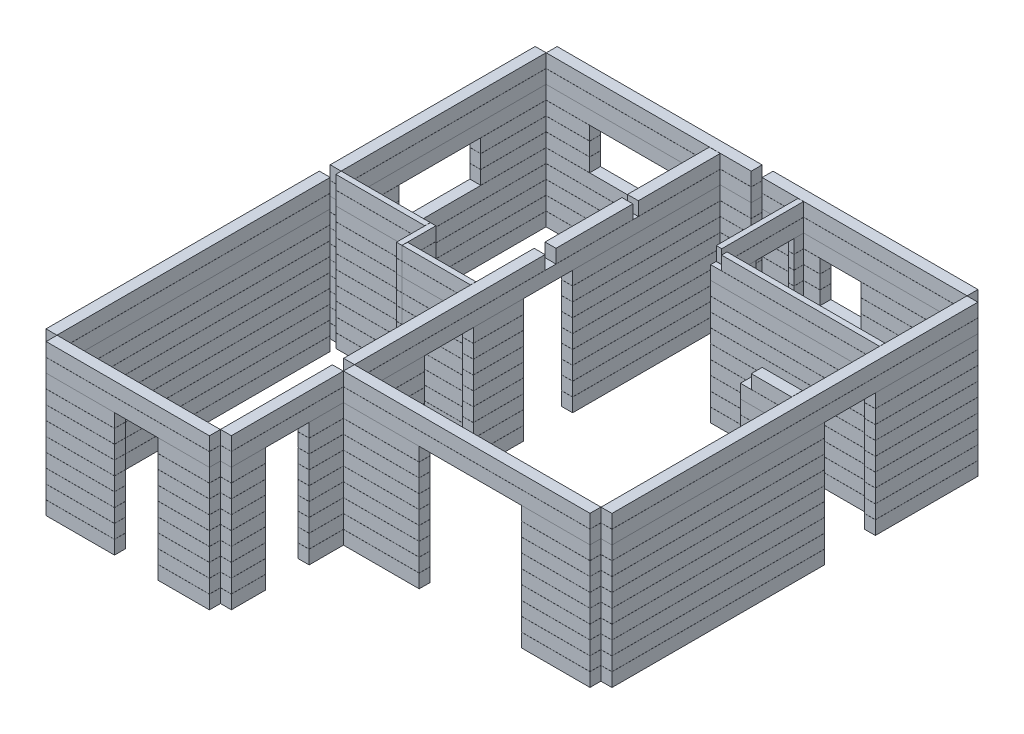
from build123d import *

# Parameters (mm, degrees)
SKETCH_1_W             = 200
SKETCH_1_H             = 1881
EXTRUDE_3_DEPTH        = 250
SKETCH_1_W_2           = 3762
SKETCH_1_H_2           = 200
EXTRUDE_3_2_DEPTH      = 250
SKETCH_1_H_3           = 3762
EXTRUDE_3_3_DEPTH      = 250
SKETCH_1_W_3           = 1254
EXTRUDE_3_4_DEPTH      = 250
SKETCH_1_H_4           = 627
EXTRUDE_3_5_DEPTH      = 250
EXTRUDE_3_6_DEPTH      = 250
EXTRUDE_3_7_DEPTH      = 250
SKETCH_1_W_4           = 942
EXTRUDE_3_8_DEPTH      = 250
SKETCH_1_W_5           = 1390
EXTRUDE_3_9_DEPTH      = 250
SKETCH_1_H_5           = 3904
EXTRUDE_3_10_DEPTH     = 250
SKETCH_1_W_6           = 100
SKETCH_1_H_6           = 173
EXTRUDE_3_11_DEPTH     = 250
SKETCH_1_H_7           = 2709
EXTRUDE_3_12_DEPTH     = 250
SKETCH_1_H_8           = 1281
EXTRUDE_3_13_DEPTH     = 250
SKETCH_1_H_9           = 622
EXTRUDE_3_14_DEPTH     = 250
SKETCH_1_W_7           = 1633
SKETCH_1_H_10          = 100
EXTRUDE_3_15_DEPTH     = 250
EXTRUDE_3_16_DEPTH     = 250
SKETCH_1_W_8           = 3097
EXTRUDE_3_17_DEPTH     = 250
EXTRUDE_3_18_DEPTH     = 250
SKETCH_1_H_11          = 922
EXTRUDE_3_19_DEPTH     = 250
SKETCH_1_W_9           = 940
EXTRUDE_3_20_DEPTH     = 250
SKETCH_1_H_12          = 5016
EXTRUDE_3_21_DEPTH     = 250
EXTRUDE_3_22_DEPTH     = 250
PATTERN_LINEAR_1_COUNT = 9
PATTERN_LINEAR_1_PITCH = 252
SKETCH_2_W             = 1500
SKETCH_2_H             = 754
CUT_EXTRUDE_2_DEPTH    = 250
SKETCH_3_W             = 1500
SKETCH_3_H             = 754
SKETCH_3_W_2           = 750
CUT_EXTRUDE_3_DEPTH    = 593
SKETCH_4_W             = 3762
SKETCH_4_H             = 200
EXTRUDE_4_DEPTH        = 250
EXTRUDE_4_2_DEPTH      = 250
SKETCH_4_W_2           = 100
SKETCH_4_H_2           = 1500
EXTRUDE_4_3_DEPTH      = 250
SKETCH_4_W_3           = 3097
SKETCH_4_H_3           = 100
EXTRUDE_4_4_DEPTH      = 250
SKETCH_4_W_4           = 200
SKETCH_4_H_4           = 6715
EXTRUDE_4_5_DEPTH      = 250
SKETCH_4_W_5           = 940
EXTRUDE_4_6_DEPTH      = 250
SKETCH_4_H_5           = 6712
EXTRUDE_4_7_DEPTH      = 250
SKETCH_4_W_6           = 4525
EXTRUDE_4_8_DEPTH      = 250
SKETCH_4_H_6           = 2054
EXTRUDE_4_9_DEPTH      = 250
SKETCH_4_W_7           = 2996
EXTRUDE_4_10_DEPTH     = 250
SKETCH_4_H_7           = 5016
EXTRUDE_4_11_DEPTH     = 250
SKETCH_4_H_8           = 3762
EXTRUDE_4_12_DEPTH     = 250
SKETCH_4_W_8           = 1633
EXTRUDE_4_13_DEPTH     = 250
SKETCH_4_H_9           = 622
EXTRUDE_4_14_DEPTH     = 250
SKETCH_4_W_9           = 1254
EXTRUDE_4_15_DEPTH     = 250
EXTRUDE_START          = 252
SKETCH_4_2_W           = 3762
SKETCH_4_2_H           = 200
EXTRUDE_5_DEPTH        = 250
EXTRUDE_5_2_DEPTH      = 250
SKETCH_4_2_W_2         = 100
SKETCH_4_2_H_2         = 1500
EXTRUDE_5_3_DEPTH      = 250
SKETCH_4_2_W_3         = 3097
SKETCH_4_2_H_3         = 100
EXTRUDE_5_4_DEPTH      = 250
SKETCH_4_2_W_4         = 200
SKETCH_4_2_H_4         = 6715
EXTRUDE_5_5_DEPTH      = 250
SKETCH_4_2_W_5         = 940
EXTRUDE_5_6_DEPTH      = 250
SKETCH_4_2_H_5         = 6712
EXTRUDE_5_7_DEPTH      = 250
SKETCH_4_2_W_6         = 4525
EXTRUDE_5_8_DEPTH      = 250
SKETCH_4_2_H_6         = 2054
EXTRUDE_5_9_DEPTH      = 250
SKETCH_4_2_W_7         = 2996
EXTRUDE_5_10_DEPTH     = 250
SKETCH_4_2_H_7         = 5016
EXTRUDE_5_11_DEPTH     = 250
SKETCH_4_2_H_8         = 3762
EXTRUDE_5_12_DEPTH     = 250
SKETCH_4_2_W_8         = 1633
EXTRUDE_5_13_DEPTH     = 250
SKETCH_4_2_H_9         = 622
EXTRUDE_5_14_DEPTH     = 250
SKETCH_4_2_W_9         = 1254
EXTRUDE_5_15_DEPTH     = 250
SKETCH_5_W             = 3985
SKETCH_5_H             = 200
SKETCH_5_W_2           = 1828
SKETCH_5_H_2           = 100
CUT_EXTRUDE_4_DEPTH    = 250


with BuildPart() as part:
    # Эскиз1 → Бобышка-Вытянуть3 (new body)
    with BuildSketch(Plane(origin=(0, 0, 0), x_dir=(1, 0, 0), z_dir=(0, 1, 0))):
        with Locations((8027, -1143.5)):
            Rectangle(SKETCH_1_W, SKETCH_1_H)
    extrude_3 = extrude(amount=EXTRUDE_3_DEPTH)


with BuildPart() as body_2:
    # Эскиз1 → Extrude 3 2 (new body)
    with BuildSketch(Plane(origin=(0, 0, 0), x_dir=(1, 0, 0), z_dir=(0, 1, 0))):
        with Locations((2084, -100)):
            Rectangle(SKETCH_1_W_2, SKETCH_1_H_2)
    extrude_3_2 = extrude(amount=EXTRUDE_3_2_DEPTH)


with BuildPart() as body_3:
    # Эскиз1 → Extrude 3 3 (new body)
    with BuildSketch(Plane(origin=(0, 0, 0), x_dir=(1, 0, 0), z_dir=(0, 1, 0))):
        with Locations((100, -2081)):
            Rectangle(SKETCH_1_W, SKETCH_1_H_3)
    extrude_3_3 = extrude(amount=EXTRUDE_3_3_DEPTH)


with BuildPart() as body_4:
    # Эскиз1 → Extrude 3 4 (new body)
    with BuildSketch(Plane(origin=(0, 0, 0), x_dir=(1, 0, 0), z_dir=(0, 1, 0))):
        with Locations((830, -9278)):
            Rectangle(SKETCH_1_W_3, SKETCH_1_H_2)
    extrude_3_4 = extrude(amount=EXTRUDE_3_4_DEPTH)


with BuildPart() as body_5:
    # Эскиз1 → Extrude 3 5 (new body)
    with BuildSketch(Plane(origin=(0, 0, 0), x_dir=(1, 0, 0), z_dir=(0, 1, 0))):
        with Locations((3299, -8861.5)):
            Rectangle(SKETCH_1_W, SKETCH_1_H_4)
    extrude_3_5 = extrude(amount=EXTRUDE_3_5_DEPTH)


with BuildPart() as body_6:
    # Эскиз1 → Extrude 3 6 (new body)
    with BuildSketch(Plane(origin=(0, 0, 0), x_dir=(1, 0, 0), z_dir=(0, 1, 0))):
        with Locations((3299, -7434.5)):
            Rectangle(SKETCH_1_W, SKETCH_1_H_4)
    extrude_3_6 = extrude(amount=EXTRUDE_3_6_DEPTH)


with BuildPart() as body_7:
    # Эскиз1 → Extrude 3 7 (new body)
    with BuildSketch(Plane(origin=(0, 0, 0), x_dir=(1, 0, 0), z_dir=(0, 1, 0))):
        with Locations((7297, -7018)):
            Rectangle(SKETCH_1_W_3, SKETCH_1_H_2)
    extrude_3_7 = extrude(amount=EXTRUDE_3_7_DEPTH)


with BuildPart() as body_8:
    # Эскиз1 → Extrude 3 8 (new body)
    with BuildSketch(Plane(origin=(0, 0, 0), x_dir=(1, 0, 0), z_dir=(0, 1, 0))):
        with Locations((2728, -9278)):
            Rectangle(SKETCH_1_W_4, SKETCH_1_H_2)
    extrude_3_8 = extrude(amount=EXTRUDE_3_8_DEPTH)


with BuildPart() as body_9:
    # Эскиз1 → Extrude 3 9 (new body)
    with BuildSketch(Plane(origin=(0, 0, 0), x_dir=(1, 0, 0), z_dir=(0, 1, 0))):
        with Locations((4094, -7018)):
            Rectangle(SKETCH_1_W_5, SKETCH_1_H_2)
    extrude_3_9 = extrude(amount=EXTRUDE_3_9_DEPTH)


with BuildPart() as body_10:
    # Эскиз1 → Extrude 3 10 (new body)
    with BuildSketch(Plane(origin=(0, 0, 0), x_dir=(1, 0, 0), z_dir=(0, 1, 0))):
        with Locations((8027, -4966)):
            Rectangle(SKETCH_1_W, SKETCH_1_H_5)
    extrude_3_10 = extrude(amount=EXTRUDE_3_10_DEPTH)


with BuildPart() as body_11:
    # Эскиз1 → Extrude 3 11 (new body)
    with BuildSketch(Plane(origin=(0, 0, 0), x_dir=(1, 0, 0), z_dir=(0, 1, 0))):
        with Locations((4877, -289.5)):
            Rectangle(SKETCH_1_W_6, SKETCH_1_H_6)
    extrude_3_11 = extrude(amount=EXTRUDE_3_11_DEPTH)


with BuildPart() as body_12:
    # Эскиз1 → Extrude 3 12 (new body)
    with BuildSketch(Plane(origin=(0, 0, 0), x_dir=(1, 0, 0), z_dir=(0, 1, 0))):
        with Locations((3299, -1557.5)):
            Rectangle(SKETCH_1_W, SKETCH_1_H_7)
    extrude_3_12 = extrude(amount=EXTRUDE_3_12_DEPTH)


with BuildPart() as body_13:
    # Эскиз1 → Extrude 3 13 (new body)
    with BuildSketch(Plane(origin=(0, 0, 0), x_dir=(1, 0, 0), z_dir=(0, 1, 0))):
        with Locations((3299, -6274.5)):
            Rectangle(SKETCH_1_W, SKETCH_1_H_8)
    extrude_3_13 = extrude(amount=EXTRUDE_3_13_DEPTH)


with BuildPart() as body_14:
    # Эскиз1 → Extrude 3 14 (new body)
    with BuildSketch(Plane(origin=(0, 0, 0), x_dir=(1, 0, 0), z_dir=(0, 1, 0))):
        with Locations((1889, -4273)):
            Rectangle(SKETCH_1_W_6, SKETCH_1_H_9)
    extrude_3_14 = extrude(amount=EXTRUDE_3_14_DEPTH)


with BuildPart() as body_15:
    # Эскиз1 → Extrude 3 15 (new body)
    with BuildSketch(Plane(origin=(0, 0, 0), x_dir=(1, 0, 0), z_dir=(0, 1, 0))):
        with Locations((1019.5, -4012)):
            Rectangle(SKETCH_1_W_7, SKETCH_1_H_10)
    extrude_3_15 = extrude(amount=EXTRUDE_3_15_DEPTH)


with BuildPart() as body_16:
    # Эскиз1 → Extrude 3 16 (new body)
    with BuildSketch(Plane(origin=(0, 0, 0), x_dir=(1, 0, 0), z_dir=(0, 1, 0))):
        with Locations((2569, -4534)):
            Rectangle(SKETCH_1_W_3, SKETCH_1_H_10)
    extrude_3_16 = extrude(amount=EXTRUDE_3_16_DEPTH)


with BuildPart() as body_17:
    # Эскиз1 → Extrude 3 17 (new body)
    with BuildSketch(Plane(origin=(0, 0, 0), x_dir=(1, 0, 0), z_dir=(0, 1, 0))):
        with Locations((6375.5, -1756)):
            Rectangle(SKETCH_1_W_8, SKETCH_1_H_10)
    extrude_3_17 = extrude(amount=EXTRUDE_3_17_DEPTH)


with BuildPart() as body_18:
    # Эскиз1 → Extrude 3 18 (new body)
    with BuildSketch(Plane(origin=(0, 0, 0), x_dir=(1, 0, 0), z_dir=(0, 1, 0))):
        with Locations((4877, -1389.5)):
            Rectangle(SKETCH_1_W_6, SKETCH_1_H_4)
    extrude_3_18 = extrude(amount=EXTRUDE_3_18_DEPTH)


with BuildPart() as body_19:
    # Эскиз1 → Extrude 3 19 (new body)
    with BuildSketch(Plane(origin=(0, 0, 0), x_dir=(1, 0, 0), z_dir=(0, 1, 0))):
        with Locations((3299, -4273)):
            Rectangle(SKETCH_1_W, SKETCH_1_H_11)
    extrude_3_19 = extrude(amount=EXTRUDE_3_19_DEPTH)


with BuildPart() as body_20:
    # Эскиз1 → Extrude 3 20 (new body)
    with BuildSketch(Plane(origin=(0, 0, 0), x_dir=(1, 0, 0), z_dir=(0, 1, 0))):
        with Locations((7454, -3318)):
            Rectangle(SKETCH_1_W_9, SKETCH_1_H_2)
    extrude_3_20 = extrude(amount=EXTRUDE_3_20_DEPTH)


with BuildPart() as body_21:
    # Эскиз1 → Extrude 3 21 (new body)
    with BuildSketch(Plane(origin=(0, 0, 0), x_dir=(1, 0, 0), z_dir=(0, 1, 0))):
        with Locations((100, -6670)):
            Rectangle(SKETCH_1_W, SKETCH_1_H_12)
    extrude_3_21 = extrude(amount=EXTRUDE_3_21_DEPTH)


with BuildPart() as body_22:
    # Эскиз1 → Extrude 3 22 (new body)
    with BuildSketch(Plane(origin=(0, 0, 0), x_dir=(1, 0, 0), z_dir=(0, 1, 0))):
        with Locations((6046, -100)):
            Rectangle(SKETCH_1_W_2, SKETCH_1_H_2)
    extrude_3_22 = extrude(amount=EXTRUDE_3_22_DEPTH)


with BuildPart() as pattern_linear_1_1:
    # Линейный массив1: pattern copy
    add(extrude_3.moved(Location(Vector(0, 1, 0) * (1 * PATTERN_LINEAR_1_PITCH))))


with BuildPart() as pattern_linear_1_2:
    # Линейный массив1: pattern copy
    add(extrude_3.moved(Location(Vector(0, 1, 0) * (2 * PATTERN_LINEAR_1_PITCH))))


with BuildPart() as pattern_linear_1_3:
    # Линейный массив1: pattern copy
    add(extrude_3.moved(Location(Vector(0, 1, 0) * (3 * PATTERN_LINEAR_1_PITCH))))


with BuildPart() as pattern_linear_1_4:
    # Линейный массив1: pattern copy
    add(extrude_3.moved(Location(Vector(0, 1, 0) * (4 * PATTERN_LINEAR_1_PITCH))))


with BuildPart() as pattern_linear_1_5:
    # Линейный массив1: pattern copy
    add(extrude_3.moved(Location(Vector(0, 1, 0) * (5 * PATTERN_LINEAR_1_PITCH))))


with BuildPart() as pattern_linear_1_6:
    # Линейный массив1: pattern copy
    add(extrude_3.moved(Location(Vector(0, 1, 0) * (6 * PATTERN_LINEAR_1_PITCH))))


with BuildPart() as pattern_linear_1_7:
    # Линейный массив1: pattern copy
    add(extrude_3.moved(Location(Vector(0, 1, 0) * (7 * PATTERN_LINEAR_1_PITCH))))


with BuildPart() as pattern_linear_1_8:
    # Линейный массив1: pattern copy
    add(extrude_3.moved(Location(Vector(0, 1, 0) * (8 * PATTERN_LINEAR_1_PITCH))))


with BuildPart() as pattern_linear_1_9:
    # Линейный массив1: pattern copy
    add(extrude_3_2.moved(Location(Vector(0, 1, 0) * (1 * PATTERN_LINEAR_1_PITCH))))


with BuildPart() as pattern_linear_1_10:
    # Линейный массив1: pattern copy
    add(extrude_3_2.moved(Location(Vector(0, 1, 0) * (2 * PATTERN_LINEAR_1_PITCH))))


with BuildPart() as pattern_linear_1_11:
    # Линейный массив1: pattern copy
    add(extrude_3_2.moved(Location(Vector(0, 1, 0) * (3 * PATTERN_LINEAR_1_PITCH))))


with BuildPart() as pattern_linear_1_12:
    # Линейный массив1: pattern copy
    add(extrude_3_2.moved(Location(Vector(0, 1, 0) * (4 * PATTERN_LINEAR_1_PITCH))))


with BuildPart() as pattern_linear_1_13:
    # Линейный массив1: pattern copy
    add(extrude_3_2.moved(Location(Vector(0, 1, 0) * (5 * PATTERN_LINEAR_1_PITCH))))


with BuildPart() as pattern_linear_1_14:
    # Линейный массив1: pattern copy
    add(extrude_3_2.moved(Location(Vector(0, 1, 0) * (6 * PATTERN_LINEAR_1_PITCH))))


with BuildPart() as pattern_linear_1_15:
    # Линейный массив1: pattern copy
    add(extrude_3_2.moved(Location(Vector(0, 1, 0) * (7 * PATTERN_LINEAR_1_PITCH))))


with BuildPart() as pattern_linear_1_16:
    # Линейный массив1: pattern copy
    add(extrude_3_2.moved(Location(Vector(0, 1, 0) * (8 * PATTERN_LINEAR_1_PITCH))))


with BuildPart() as pattern_linear_1_17:
    # Линейный массив1: pattern copy
    add(extrude_3_3.moved(Location(Vector(0, 1, 0) * (1 * PATTERN_LINEAR_1_PITCH))))


with BuildPart() as pattern_linear_1_18:
    # Линейный массив1: pattern copy
    add(extrude_3_3.moved(Location(Vector(0, 1, 0) * (2 * PATTERN_LINEAR_1_PITCH))))


with BuildPart() as pattern_linear_1_19:
    # Линейный массив1: pattern copy
    add(extrude_3_3.moved(Location(Vector(0, 1, 0) * (3 * PATTERN_LINEAR_1_PITCH))))


with BuildPart() as pattern_linear_1_20:
    # Линейный массив1: pattern copy
    add(extrude_3_3.moved(Location(Vector(0, 1, 0) * (4 * PATTERN_LINEAR_1_PITCH))))


with BuildPart() as pattern_linear_1_21:
    # Линейный массив1: pattern copy
    add(extrude_3_3.moved(Location(Vector(0, 1, 0) * (5 * PATTERN_LINEAR_1_PITCH))))


with BuildPart() as pattern_linear_1_22:
    # Линейный массив1: pattern copy
    add(extrude_3_3.moved(Location(Vector(0, 1, 0) * (6 * PATTERN_LINEAR_1_PITCH))))


with BuildPart() as pattern_linear_1_23:
    # Линейный массив1: pattern copy
    add(extrude_3_3.moved(Location(Vector(0, 1, 0) * (7 * PATTERN_LINEAR_1_PITCH))))


with BuildPart() as pattern_linear_1_24:
    # Линейный массив1: pattern copy
    add(extrude_3_3.moved(Location(Vector(0, 1, 0) * (8 * PATTERN_LINEAR_1_PITCH))))


with BuildPart() as pattern_linear_1_25:
    # Линейный массив1: pattern copy
    add(extrude_3_4.moved(Location(Vector(0, 1, 0) * (1 * PATTERN_LINEAR_1_PITCH))))


with BuildPart() as pattern_linear_1_26:
    # Линейный массив1: pattern copy
    add(extrude_3_4.moved(Location(Vector(0, 1, 0) * (2 * PATTERN_LINEAR_1_PITCH))))


with BuildPart() as pattern_linear_1_27:
    # Линейный массив1: pattern copy
    add(extrude_3_4.moved(Location(Vector(0, 1, 0) * (3 * PATTERN_LINEAR_1_PITCH))))


with BuildPart() as pattern_linear_1_28:
    # Линейный массив1: pattern copy
    add(extrude_3_4.moved(Location(Vector(0, 1, 0) * (4 * PATTERN_LINEAR_1_PITCH))))


with BuildPart() as pattern_linear_1_29:
    # Линейный массив1: pattern copy
    add(extrude_3_4.moved(Location(Vector(0, 1, 0) * (5 * PATTERN_LINEAR_1_PITCH))))


with BuildPart() as pattern_linear_1_30:
    # Линейный массив1: pattern copy
    add(extrude_3_4.moved(Location(Vector(0, 1, 0) * (6 * PATTERN_LINEAR_1_PITCH))))


with BuildPart() as pattern_linear_1_31:
    # Линейный массив1: pattern copy
    add(extrude_3_4.moved(Location(Vector(0, 1, 0) * (7 * PATTERN_LINEAR_1_PITCH))))


with BuildPart() as pattern_linear_1_32:
    # Линейный массив1: pattern copy
    add(extrude_3_4.moved(Location(Vector(0, 1, 0) * (8 * PATTERN_LINEAR_1_PITCH))))


with BuildPart() as pattern_linear_1_33:
    # Линейный массив1: pattern copy
    add(extrude_3_5.moved(Location(Vector(0, 1, 0) * (1 * PATTERN_LINEAR_1_PITCH))))


with BuildPart() as pattern_linear_1_34:
    # Линейный массив1: pattern copy
    add(extrude_3_5.moved(Location(Vector(0, 1, 0) * (2 * PATTERN_LINEAR_1_PITCH))))


with BuildPart() as pattern_linear_1_35:
    # Линейный массив1: pattern copy
    add(extrude_3_5.moved(Location(Vector(0, 1, 0) * (3 * PATTERN_LINEAR_1_PITCH))))


with BuildPart() as pattern_linear_1_36:
    # Линейный массив1: pattern copy
    add(extrude_3_5.moved(Location(Vector(0, 1, 0) * (4 * PATTERN_LINEAR_1_PITCH))))


with BuildPart() as pattern_linear_1_37:
    # Линейный массив1: pattern copy
    add(extrude_3_5.moved(Location(Vector(0, 1, 0) * (5 * PATTERN_LINEAR_1_PITCH))))


with BuildPart() as pattern_linear_1_38:
    # Линейный массив1: pattern copy
    add(extrude_3_5.moved(Location(Vector(0, 1, 0) * (6 * PATTERN_LINEAR_1_PITCH))))


with BuildPart() as pattern_linear_1_39:
    # Линейный массив1: pattern copy
    add(extrude_3_5.moved(Location(Vector(0, 1, 0) * (7 * PATTERN_LINEAR_1_PITCH))))


with BuildPart() as pattern_linear_1_40:
    # Линейный массив1: pattern copy
    add(extrude_3_5.moved(Location(Vector(0, 1, 0) * (8 * PATTERN_LINEAR_1_PITCH))))


with BuildPart() as pattern_linear_1_41:
    # Линейный массив1: pattern copy
    add(extrude_3_6.moved(Location(Vector(0, 1, 0) * (1 * PATTERN_LINEAR_1_PITCH))))


with BuildPart() as pattern_linear_1_42:
    # Линейный массив1: pattern copy
    add(extrude_3_6.moved(Location(Vector(0, 1, 0) * (2 * PATTERN_LINEAR_1_PITCH))))


with BuildPart() as pattern_linear_1_43:
    # Линейный массив1: pattern copy
    add(extrude_3_6.moved(Location(Vector(0, 1, 0) * (3 * PATTERN_LINEAR_1_PITCH))))


with BuildPart() as pattern_linear_1_44:
    # Линейный массив1: pattern copy
    add(extrude_3_6.moved(Location(Vector(0, 1, 0) * (4 * PATTERN_LINEAR_1_PITCH))))


with BuildPart() as pattern_linear_1_45:
    # Линейный массив1: pattern copy
    add(extrude_3_6.moved(Location(Vector(0, 1, 0) * (5 * PATTERN_LINEAR_1_PITCH))))


with BuildPart() as pattern_linear_1_46:
    # Линейный массив1: pattern copy
    add(extrude_3_6.moved(Location(Vector(0, 1, 0) * (6 * PATTERN_LINEAR_1_PITCH))))


with BuildPart() as pattern_linear_1_47:
    # Линейный массив1: pattern copy
    add(extrude_3_6.moved(Location(Vector(0, 1, 0) * (7 * PATTERN_LINEAR_1_PITCH))))


with BuildPart() as pattern_linear_1_48:
    # Линейный массив1: pattern copy
    add(extrude_3_6.moved(Location(Vector(0, 1, 0) * (8 * PATTERN_LINEAR_1_PITCH))))


with BuildPart() as pattern_linear_1_49:
    # Линейный массив1: pattern copy
    add(extrude_3_7.moved(Location(Vector(0, 1, 0) * (1 * PATTERN_LINEAR_1_PITCH))))


with BuildPart() as pattern_linear_1_50:
    # Линейный массив1: pattern copy
    add(extrude_3_7.moved(Location(Vector(0, 1, 0) * (2 * PATTERN_LINEAR_1_PITCH))))


with BuildPart() as pattern_linear_1_51:
    # Линейный массив1: pattern copy
    add(extrude_3_7.moved(Location(Vector(0, 1, 0) * (3 * PATTERN_LINEAR_1_PITCH))))


with BuildPart() as pattern_linear_1_52:
    # Линейный массив1: pattern copy
    add(extrude_3_7.moved(Location(Vector(0, 1, 0) * (4 * PATTERN_LINEAR_1_PITCH))))


with BuildPart() as pattern_linear_1_53:
    # Линейный массив1: pattern copy
    add(extrude_3_7.moved(Location(Vector(0, 1, 0) * (5 * PATTERN_LINEAR_1_PITCH))))


with BuildPart() as pattern_linear_1_54:
    # Линейный массив1: pattern copy
    add(extrude_3_7.moved(Location(Vector(0, 1, 0) * (6 * PATTERN_LINEAR_1_PITCH))))


with BuildPart() as pattern_linear_1_55:
    # Линейный массив1: pattern copy
    add(extrude_3_7.moved(Location(Vector(0, 1, 0) * (7 * PATTERN_LINEAR_1_PITCH))))


with BuildPart() as pattern_linear_1_56:
    # Линейный массив1: pattern copy
    add(extrude_3_7.moved(Location(Vector(0, 1, 0) * (8 * PATTERN_LINEAR_1_PITCH))))


with BuildPart() as pattern_linear_1_57:
    # Линейный массив1: pattern copy
    add(extrude_3_8.moved(Location(Vector(0, 1, 0) * (1 * PATTERN_LINEAR_1_PITCH))))


with BuildPart() as pattern_linear_1_58:
    # Линейный массив1: pattern copy
    add(extrude_3_8.moved(Location(Vector(0, 1, 0) * (2 * PATTERN_LINEAR_1_PITCH))))


with BuildPart() as pattern_linear_1_59:
    # Линейный массив1: pattern copy
    add(extrude_3_8.moved(Location(Vector(0, 1, 0) * (3 * PATTERN_LINEAR_1_PITCH))))


with BuildPart() as pattern_linear_1_60:
    # Линейный массив1: pattern copy
    add(extrude_3_8.moved(Location(Vector(0, 1, 0) * (4 * PATTERN_LINEAR_1_PITCH))))


with BuildPart() as pattern_linear_1_61:
    # Линейный массив1: pattern copy
    add(extrude_3_8.moved(Location(Vector(0, 1, 0) * (5 * PATTERN_LINEAR_1_PITCH))))


with BuildPart() as pattern_linear_1_62:
    # Линейный массив1: pattern copy
    add(extrude_3_8.moved(Location(Vector(0, 1, 0) * (6 * PATTERN_LINEAR_1_PITCH))))


with BuildPart() as pattern_linear_1_63:
    # Линейный массив1: pattern copy
    add(extrude_3_8.moved(Location(Vector(0, 1, 0) * (7 * PATTERN_LINEAR_1_PITCH))))


with BuildPart() as pattern_linear_1_64:
    # Линейный массив1: pattern copy
    add(extrude_3_8.moved(Location(Vector(0, 1, 0) * (8 * PATTERN_LINEAR_1_PITCH))))


with BuildPart() as pattern_linear_1_65:
    # Линейный массив1: pattern copy
    add(extrude_3_9.moved(Location(Vector(0, 1, 0) * (1 * PATTERN_LINEAR_1_PITCH))))


with BuildPart() as pattern_linear_1_66:
    # Линейный массив1: pattern copy
    add(extrude_3_9.moved(Location(Vector(0, 1, 0) * (2 * PATTERN_LINEAR_1_PITCH))))


with BuildPart() as pattern_linear_1_67:
    # Линейный массив1: pattern copy
    add(extrude_3_9.moved(Location(Vector(0, 1, 0) * (3 * PATTERN_LINEAR_1_PITCH))))


with BuildPart() as pattern_linear_1_68:
    # Линейный массив1: pattern copy
    add(extrude_3_9.moved(Location(Vector(0, 1, 0) * (4 * PATTERN_LINEAR_1_PITCH))))


with BuildPart() as pattern_linear_1_69:
    # Линейный массив1: pattern copy
    add(extrude_3_9.moved(Location(Vector(0, 1, 0) * (5 * PATTERN_LINEAR_1_PITCH))))


with BuildPart() as pattern_linear_1_70:
    # Линейный массив1: pattern copy
    add(extrude_3_9.moved(Location(Vector(0, 1, 0) * (6 * PATTERN_LINEAR_1_PITCH))))


with BuildPart() as pattern_linear_1_71:
    # Линейный массив1: pattern copy
    add(extrude_3_9.moved(Location(Vector(0, 1, 0) * (7 * PATTERN_LINEAR_1_PITCH))))


with BuildPart() as pattern_linear_1_72:
    # Линейный массив1: pattern copy
    add(extrude_3_9.moved(Location(Vector(0, 1, 0) * (8 * PATTERN_LINEAR_1_PITCH))))


with BuildPart() as pattern_linear_1_73:
    # Линейный массив1: pattern copy
    add(extrude_3_10.moved(Location(Vector(0, 1, 0) * (1 * PATTERN_LINEAR_1_PITCH))))


with BuildPart() as pattern_linear_1_74:
    # Линейный массив1: pattern copy
    add(extrude_3_10.moved(Location(Vector(0, 1, 0) * (2 * PATTERN_LINEAR_1_PITCH))))


with BuildPart() as pattern_linear_1_75:
    # Линейный массив1: pattern copy
    add(extrude_3_10.moved(Location(Vector(0, 1, 0) * (3 * PATTERN_LINEAR_1_PITCH))))


with BuildPart() as pattern_linear_1_76:
    # Линейный массив1: pattern copy
    add(extrude_3_10.moved(Location(Vector(0, 1, 0) * (4 * PATTERN_LINEAR_1_PITCH))))


with BuildPart() as pattern_linear_1_77:
    # Линейный массив1: pattern copy
    add(extrude_3_10.moved(Location(Vector(0, 1, 0) * (5 * PATTERN_LINEAR_1_PITCH))))


with BuildPart() as pattern_linear_1_78:
    # Линейный массив1: pattern copy
    add(extrude_3_10.moved(Location(Vector(0, 1, 0) * (6 * PATTERN_LINEAR_1_PITCH))))


with BuildPart() as pattern_linear_1_79:
    # Линейный массив1: pattern copy
    add(extrude_3_10.moved(Location(Vector(0, 1, 0) * (7 * PATTERN_LINEAR_1_PITCH))))


with BuildPart() as pattern_linear_1_80:
    # Линейный массив1: pattern copy
    add(extrude_3_10.moved(Location(Vector(0, 1, 0) * (8 * PATTERN_LINEAR_1_PITCH))))


with BuildPart() as pattern_linear_1_81:
    # Линейный массив1: pattern copy
    add(extrude_3_11.moved(Location(Vector(0, 1, 0) * (1 * PATTERN_LINEAR_1_PITCH))))


with BuildPart() as pattern_linear_1_82:
    # Линейный массив1: pattern copy
    add(extrude_3_11.moved(Location(Vector(0, 1, 0) * (2 * PATTERN_LINEAR_1_PITCH))))


with BuildPart() as pattern_linear_1_83:
    # Линейный массив1: pattern copy
    add(extrude_3_11.moved(Location(Vector(0, 1, 0) * (3 * PATTERN_LINEAR_1_PITCH))))


with BuildPart() as pattern_linear_1_84:
    # Линейный массив1: pattern copy
    add(extrude_3_11.moved(Location(Vector(0, 1, 0) * (4 * PATTERN_LINEAR_1_PITCH))))


with BuildPart() as pattern_linear_1_85:
    # Линейный массив1: pattern copy
    add(extrude_3_11.moved(Location(Vector(0, 1, 0) * (5 * PATTERN_LINEAR_1_PITCH))))


with BuildPart() as pattern_linear_1_86:
    # Линейный массив1: pattern copy
    add(extrude_3_11.moved(Location(Vector(0, 1, 0) * (6 * PATTERN_LINEAR_1_PITCH))))


with BuildPart() as pattern_linear_1_87:
    # Линейный массив1: pattern copy
    add(extrude_3_11.moved(Location(Vector(0, 1, 0) * (7 * PATTERN_LINEAR_1_PITCH))))


with BuildPart() as pattern_linear_1_88:
    # Линейный массив1: pattern copy
    add(extrude_3_11.moved(Location(Vector(0, 1, 0) * (8 * PATTERN_LINEAR_1_PITCH))))


with BuildPart() as pattern_linear_1_89:
    # Линейный массив1: pattern copy
    add(extrude_3_12.moved(Location(Vector(0, 1, 0) * (1 * PATTERN_LINEAR_1_PITCH))))


with BuildPart() as pattern_linear_1_90:
    # Линейный массив1: pattern copy
    add(extrude_3_12.moved(Location(Vector(0, 1, 0) * (2 * PATTERN_LINEAR_1_PITCH))))


with BuildPart() as pattern_linear_1_91:
    # Линейный массив1: pattern copy
    add(extrude_3_12.moved(Location(Vector(0, 1, 0) * (3 * PATTERN_LINEAR_1_PITCH))))


with BuildPart() as pattern_linear_1_92:
    # Линейный массив1: pattern copy
    add(extrude_3_12.moved(Location(Vector(0, 1, 0) * (4 * PATTERN_LINEAR_1_PITCH))))


with BuildPart() as pattern_linear_1_93:
    # Линейный массив1: pattern copy
    add(extrude_3_12.moved(Location(Vector(0, 1, 0) * (5 * PATTERN_LINEAR_1_PITCH))))


with BuildPart() as pattern_linear_1_94:
    # Линейный массив1: pattern copy
    add(extrude_3_12.moved(Location(Vector(0, 1, 0) * (6 * PATTERN_LINEAR_1_PITCH))))


with BuildPart() as pattern_linear_1_95:
    # Линейный массив1: pattern copy
    add(extrude_3_12.moved(Location(Vector(0, 1, 0) * (7 * PATTERN_LINEAR_1_PITCH))))


with BuildPart() as pattern_linear_1_96:
    # Линейный массив1: pattern copy
    add(extrude_3_12.moved(Location(Vector(0, 1, 0) * (8 * PATTERN_LINEAR_1_PITCH))))


with BuildPart() as pattern_linear_1_97:
    # Линейный массив1: pattern copy
    add(extrude_3_13.moved(Location(Vector(0, 1, 0) * (1 * PATTERN_LINEAR_1_PITCH))))


with BuildPart() as pattern_linear_1_98:
    # Линейный массив1: pattern copy
    add(extrude_3_13.moved(Location(Vector(0, 1, 0) * (2 * PATTERN_LINEAR_1_PITCH))))


with BuildPart() as pattern_linear_1_99:
    # Линейный массив1: pattern copy
    add(extrude_3_13.moved(Location(Vector(0, 1, 0) * (3 * PATTERN_LINEAR_1_PITCH))))


with BuildPart() as pattern_linear_1_100:
    # Линейный массив1: pattern copy
    add(extrude_3_13.moved(Location(Vector(0, 1, 0) * (4 * PATTERN_LINEAR_1_PITCH))))


with BuildPart() as pattern_linear_1_101:
    # Линейный массив1: pattern copy
    add(extrude_3_13.moved(Location(Vector(0, 1, 0) * (5 * PATTERN_LINEAR_1_PITCH))))


with BuildPart() as pattern_linear_1_102:
    # Линейный массив1: pattern copy
    add(extrude_3_13.moved(Location(Vector(0, 1, 0) * (6 * PATTERN_LINEAR_1_PITCH))))


with BuildPart() as pattern_linear_1_103:
    # Линейный массив1: pattern copy
    add(extrude_3_13.moved(Location(Vector(0, 1, 0) * (7 * PATTERN_LINEAR_1_PITCH))))


with BuildPart() as pattern_linear_1_104:
    # Линейный массив1: pattern copy
    add(extrude_3_13.moved(Location(Vector(0, 1, 0) * (8 * PATTERN_LINEAR_1_PITCH))))


with BuildPart() as pattern_linear_1_105:
    # Линейный массив1: pattern copy
    add(extrude_3_14.moved(Location(Vector(0, 1, 0) * (1 * PATTERN_LINEAR_1_PITCH))))


with BuildPart() as pattern_linear_1_106:
    # Линейный массив1: pattern copy
    add(extrude_3_14.moved(Location(Vector(0, 1, 0) * (2 * PATTERN_LINEAR_1_PITCH))))


with BuildPart() as pattern_linear_1_107:
    # Линейный массив1: pattern copy
    add(extrude_3_14.moved(Location(Vector(0, 1, 0) * (3 * PATTERN_LINEAR_1_PITCH))))


with BuildPart() as pattern_linear_1_108:
    # Линейный массив1: pattern copy
    add(extrude_3_14.moved(Location(Vector(0, 1, 0) * (4 * PATTERN_LINEAR_1_PITCH))))


with BuildPart() as pattern_linear_1_109:
    # Линейный массив1: pattern copy
    add(extrude_3_14.moved(Location(Vector(0, 1, 0) * (5 * PATTERN_LINEAR_1_PITCH))))


with BuildPart() as pattern_linear_1_110:
    # Линейный массив1: pattern copy
    add(extrude_3_14.moved(Location(Vector(0, 1, 0) * (6 * PATTERN_LINEAR_1_PITCH))))


with BuildPart() as pattern_linear_1_111:
    # Линейный массив1: pattern copy
    add(extrude_3_14.moved(Location(Vector(0, 1, 0) * (7 * PATTERN_LINEAR_1_PITCH))))


with BuildPart() as pattern_linear_1_112:
    # Линейный массив1: pattern copy
    add(extrude_3_14.moved(Location(Vector(0, 1, 0) * (8 * PATTERN_LINEAR_1_PITCH))))


with BuildPart() as pattern_linear_1_113:
    # Линейный массив1: pattern copy
    add(extrude_3_15.moved(Location(Vector(0, 1, 0) * (1 * PATTERN_LINEAR_1_PITCH))))


with BuildPart() as pattern_linear_1_114:
    # Линейный массив1: pattern copy
    add(extrude_3_15.moved(Location(Vector(0, 1, 0) * (2 * PATTERN_LINEAR_1_PITCH))))


with BuildPart() as pattern_linear_1_115:
    # Линейный массив1: pattern copy
    add(extrude_3_15.moved(Location(Vector(0, 1, 0) * (3 * PATTERN_LINEAR_1_PITCH))))


with BuildPart() as pattern_linear_1_116:
    # Линейный массив1: pattern copy
    add(extrude_3_15.moved(Location(Vector(0, 1, 0) * (4 * PATTERN_LINEAR_1_PITCH))))


with BuildPart() as pattern_linear_1_117:
    # Линейный массив1: pattern copy
    add(extrude_3_15.moved(Location(Vector(0, 1, 0) * (5 * PATTERN_LINEAR_1_PITCH))))


with BuildPart() as pattern_linear_1_118:
    # Линейный массив1: pattern copy
    add(extrude_3_15.moved(Location(Vector(0, 1, 0) * (6 * PATTERN_LINEAR_1_PITCH))))


with BuildPart() as pattern_linear_1_119:
    # Линейный массив1: pattern copy
    add(extrude_3_15.moved(Location(Vector(0, 1, 0) * (7 * PATTERN_LINEAR_1_PITCH))))


with BuildPart() as pattern_linear_1_120:
    # Линейный массив1: pattern copy
    add(extrude_3_15.moved(Location(Vector(0, 1, 0) * (8 * PATTERN_LINEAR_1_PITCH))))


with BuildPart() as pattern_linear_1_121:
    # Линейный массив1: pattern copy
    add(extrude_3_16.moved(Location(Vector(0, 1, 0) * (1 * PATTERN_LINEAR_1_PITCH))))


with BuildPart() as pattern_linear_1_122:
    # Линейный массив1: pattern copy
    add(extrude_3_16.moved(Location(Vector(0, 1, 0) * (2 * PATTERN_LINEAR_1_PITCH))))


with BuildPart() as pattern_linear_1_123:
    # Линейный массив1: pattern copy
    add(extrude_3_16.moved(Location(Vector(0, 1, 0) * (3 * PATTERN_LINEAR_1_PITCH))))


with BuildPart() as pattern_linear_1_124:
    # Линейный массив1: pattern copy
    add(extrude_3_16.moved(Location(Vector(0, 1, 0) * (4 * PATTERN_LINEAR_1_PITCH))))


with BuildPart() as pattern_linear_1_125:
    # Линейный массив1: pattern copy
    add(extrude_3_16.moved(Location(Vector(0, 1, 0) * (5 * PATTERN_LINEAR_1_PITCH))))


with BuildPart() as pattern_linear_1_126:
    # Линейный массив1: pattern copy
    add(extrude_3_16.moved(Location(Vector(0, 1, 0) * (6 * PATTERN_LINEAR_1_PITCH))))


with BuildPart() as pattern_linear_1_127:
    # Линейный массив1: pattern copy
    add(extrude_3_16.moved(Location(Vector(0, 1, 0) * (7 * PATTERN_LINEAR_1_PITCH))))


with BuildPart() as pattern_linear_1_128:
    # Линейный массив1: pattern copy
    add(extrude_3_16.moved(Location(Vector(0, 1, 0) * (8 * PATTERN_LINEAR_1_PITCH))))


with BuildPart() as pattern_linear_1_129:
    # Линейный массив1: pattern copy
    add(extrude_3_17.moved(Location(Vector(0, 1, 0) * (1 * PATTERN_LINEAR_1_PITCH))))


with BuildPart() as pattern_linear_1_130:
    # Линейный массив1: pattern copy
    add(extrude_3_17.moved(Location(Vector(0, 1, 0) * (2 * PATTERN_LINEAR_1_PITCH))))


with BuildPart() as pattern_linear_1_131:
    # Линейный массив1: pattern copy
    add(extrude_3_17.moved(Location(Vector(0, 1, 0) * (3 * PATTERN_LINEAR_1_PITCH))))


with BuildPart() as pattern_linear_1_132:
    # Линейный массив1: pattern copy
    add(extrude_3_17.moved(Location(Vector(0, 1, 0) * (4 * PATTERN_LINEAR_1_PITCH))))


with BuildPart() as pattern_linear_1_133:
    # Линейный массив1: pattern copy
    add(extrude_3_17.moved(Location(Vector(0, 1, 0) * (5 * PATTERN_LINEAR_1_PITCH))))


with BuildPart() as pattern_linear_1_134:
    # Линейный массив1: pattern copy
    add(extrude_3_17.moved(Location(Vector(0, 1, 0) * (6 * PATTERN_LINEAR_1_PITCH))))


with BuildPart() as pattern_linear_1_135:
    # Линейный массив1: pattern copy
    add(extrude_3_17.moved(Location(Vector(0, 1, 0) * (7 * PATTERN_LINEAR_1_PITCH))))


with BuildPart() as pattern_linear_1_136:
    # Линейный массив1: pattern copy
    add(extrude_3_17.moved(Location(Vector(0, 1, 0) * (8 * PATTERN_LINEAR_1_PITCH))))


with BuildPart() as pattern_linear_1_137:
    # Линейный массив1: pattern copy
    add(extrude_3_18.moved(Location(Vector(0, 1, 0) * (1 * PATTERN_LINEAR_1_PITCH))))


with BuildPart() as pattern_linear_1_138:
    # Линейный массив1: pattern copy
    add(extrude_3_18.moved(Location(Vector(0, 1, 0) * (2 * PATTERN_LINEAR_1_PITCH))))


with BuildPart() as pattern_linear_1_139:
    # Линейный массив1: pattern copy
    add(extrude_3_18.moved(Location(Vector(0, 1, 0) * (3 * PATTERN_LINEAR_1_PITCH))))


with BuildPart() as pattern_linear_1_140:
    # Линейный массив1: pattern copy
    add(extrude_3_18.moved(Location(Vector(0, 1, 0) * (4 * PATTERN_LINEAR_1_PITCH))))


with BuildPart() as pattern_linear_1_141:
    # Линейный массив1: pattern copy
    add(extrude_3_18.moved(Location(Vector(0, 1, 0) * (5 * PATTERN_LINEAR_1_PITCH))))


with BuildPart() as pattern_linear_1_142:
    # Линейный массив1: pattern copy
    add(extrude_3_18.moved(Location(Vector(0, 1, 0) * (6 * PATTERN_LINEAR_1_PITCH))))


with BuildPart() as pattern_linear_1_143:
    # Линейный массив1: pattern copy
    add(extrude_3_18.moved(Location(Vector(0, 1, 0) * (7 * PATTERN_LINEAR_1_PITCH))))


with BuildPart() as pattern_linear_1_144:
    # Линейный массив1: pattern copy
    add(extrude_3_18.moved(Location(Vector(0, 1, 0) * (8 * PATTERN_LINEAR_1_PITCH))))


with BuildPart() as pattern_linear_1_145:
    # Линейный массив1: pattern copy
    add(extrude_3_19.moved(Location(Vector(0, 1, 0) * (1 * PATTERN_LINEAR_1_PITCH))))


with BuildPart() as pattern_linear_1_146:
    # Линейный массив1: pattern copy
    add(extrude_3_19.moved(Location(Vector(0, 1, 0) * (2 * PATTERN_LINEAR_1_PITCH))))


with BuildPart() as pattern_linear_1_147:
    # Линейный массив1: pattern copy
    add(extrude_3_19.moved(Location(Vector(0, 1, 0) * (3 * PATTERN_LINEAR_1_PITCH))))


with BuildPart() as pattern_linear_1_148:
    # Линейный массив1: pattern copy
    add(extrude_3_19.moved(Location(Vector(0, 1, 0) * (4 * PATTERN_LINEAR_1_PITCH))))


with BuildPart() as pattern_linear_1_149:
    # Линейный массив1: pattern copy
    add(extrude_3_19.moved(Location(Vector(0, 1, 0) * (5 * PATTERN_LINEAR_1_PITCH))))


with BuildPart() as pattern_linear_1_150:
    # Линейный массив1: pattern copy
    add(extrude_3_19.moved(Location(Vector(0, 1, 0) * (6 * PATTERN_LINEAR_1_PITCH))))


with BuildPart() as pattern_linear_1_151:
    # Линейный массив1: pattern copy
    add(extrude_3_19.moved(Location(Vector(0, 1, 0) * (7 * PATTERN_LINEAR_1_PITCH))))


with BuildPart() as pattern_linear_1_152:
    # Линейный массив1: pattern copy
    add(extrude_3_19.moved(Location(Vector(0, 1, 0) * (8 * PATTERN_LINEAR_1_PITCH))))


with BuildPart() as pattern_linear_1_153:
    # Линейный массив1: pattern copy
    add(extrude_3_20.moved(Location(Vector(0, 1, 0) * (1 * PATTERN_LINEAR_1_PITCH))))


with BuildPart() as pattern_linear_1_154:
    # Линейный массив1: pattern copy
    add(extrude_3_20.moved(Location(Vector(0, 1, 0) * (2 * PATTERN_LINEAR_1_PITCH))))


with BuildPart() as pattern_linear_1_155:
    # Линейный массив1: pattern copy
    add(extrude_3_20.moved(Location(Vector(0, 1, 0) * (3 * PATTERN_LINEAR_1_PITCH))))


with BuildPart() as pattern_linear_1_156:
    # Линейный массив1: pattern copy
    add(extrude_3_20.moved(Location(Vector(0, 1, 0) * (4 * PATTERN_LINEAR_1_PITCH))))


with BuildPart() as pattern_linear_1_157:
    # Линейный массив1: pattern copy
    add(extrude_3_20.moved(Location(Vector(0, 1, 0) * (5 * PATTERN_LINEAR_1_PITCH))))


with BuildPart() as pattern_linear_1_158:
    # Линейный массив1: pattern copy
    add(extrude_3_20.moved(Location(Vector(0, 1, 0) * (6 * PATTERN_LINEAR_1_PITCH))))


with BuildPart() as pattern_linear_1_159:
    # Линейный массив1: pattern copy
    add(extrude_3_20.moved(Location(Vector(0, 1, 0) * (7 * PATTERN_LINEAR_1_PITCH))))


with BuildPart() as pattern_linear_1_160:
    # Линейный массив1: pattern copy
    add(extrude_3_20.moved(Location(Vector(0, 1, 0) * (8 * PATTERN_LINEAR_1_PITCH))))


with BuildPart() as pattern_linear_1_161:
    # Линейный массив1: pattern copy
    add(extrude_3_21.moved(Location(Vector(0, 1, 0) * (1 * PATTERN_LINEAR_1_PITCH))))


with BuildPart() as pattern_linear_1_162:
    # Линейный массив1: pattern copy
    add(extrude_3_21.moved(Location(Vector(0, 1, 0) * (2 * PATTERN_LINEAR_1_PITCH))))


with BuildPart() as pattern_linear_1_163:
    # Линейный массив1: pattern copy
    add(extrude_3_21.moved(Location(Vector(0, 1, 0) * (3 * PATTERN_LINEAR_1_PITCH))))


with BuildPart() as pattern_linear_1_164:
    # Линейный массив1: pattern copy
    add(extrude_3_21.moved(Location(Vector(0, 1, 0) * (4 * PATTERN_LINEAR_1_PITCH))))


with BuildPart() as pattern_linear_1_165:
    # Линейный массив1: pattern copy
    add(extrude_3_21.moved(Location(Vector(0, 1, 0) * (5 * PATTERN_LINEAR_1_PITCH))))


with BuildPart() as pattern_linear_1_166:
    # Линейный массив1: pattern copy
    add(extrude_3_21.moved(Location(Vector(0, 1, 0) * (6 * PATTERN_LINEAR_1_PITCH))))


with BuildPart() as pattern_linear_1_167:
    # Линейный массив1: pattern copy
    add(extrude_3_21.moved(Location(Vector(0, 1, 0) * (7 * PATTERN_LINEAR_1_PITCH))))


with BuildPart() as pattern_linear_1_168:
    # Линейный массив1: pattern copy
    add(extrude_3_21.moved(Location(Vector(0, 1, 0) * (8 * PATTERN_LINEAR_1_PITCH))))


with BuildPart() as pattern_linear_1_169:
    # Линейный массив1: pattern copy
    add(extrude_3_22.moved(Location(Vector(0, 1, 0) * (1 * PATTERN_LINEAR_1_PITCH))))


with BuildPart() as pattern_linear_1_170:
    # Линейный массив1: pattern copy
    add(extrude_3_22.moved(Location(Vector(0, 1, 0) * (2 * PATTERN_LINEAR_1_PITCH))))


with BuildPart() as pattern_linear_1_171:
    # Линейный массив1: pattern copy
    add(extrude_3_22.moved(Location(Vector(0, 1, 0) * (3 * PATTERN_LINEAR_1_PITCH))))


with BuildPart() as pattern_linear_1_172:
    # Линейный массив1: pattern copy
    add(extrude_3_22.moved(Location(Vector(0, 1, 0) * (4 * PATTERN_LINEAR_1_PITCH))))


with BuildPart() as pattern_linear_1_173:
    # Линейный массив1: pattern copy
    add(extrude_3_22.moved(Location(Vector(0, 1, 0) * (5 * PATTERN_LINEAR_1_PITCH))))


with BuildPart() as pattern_linear_1_174:
    # Линейный массив1: pattern copy
    add(extrude_3_22.moved(Location(Vector(0, 1, 0) * (6 * PATTERN_LINEAR_1_PITCH))))


with BuildPart() as pattern_linear_1_175:
    # Линейный массив1: pattern copy
    add(extrude_3_22.moved(Location(Vector(0, 1, 0) * (7 * PATTERN_LINEAR_1_PITCH))))


with BuildPart() as pattern_linear_1_176:
    # Линейный массив1: pattern copy
    add(extrude_3_22.moved(Location(Vector(0, 1, 0) * (8 * PATTERN_LINEAR_1_PITCH))))


with BuildPart() as cut_extrude_2_tool:
    # Эскиз2 → Вырез-Вытянуть2 (new body)
    with BuildSketch(Plane.ZY):
        with Locations((2149.658395249, 1637)):
            Rectangle(SKETCH_2_W, SKETCH_2_H)
    extrude(amount=-CUT_EXTRUDE_2_DEPTH)


with BuildPart() as pattern_linear_1_21_1:
    add(pattern_linear_1_21.part)

    # Вырез-Вытянуть2: cut by cut_extrude_2_tool
    add(cut_extrude_2_tool.part, mode=Mode.SUBTRACT)


with BuildPart() as pattern_linear_1_22_1:
    add(pattern_linear_1_22.part)

    # Вырез-Вытянуть2: cut by cut_extrude_2_tool
    add(cut_extrude_2_tool.part, mode=Mode.SUBTRACT)


with BuildPart() as pattern_linear_1_23_1:
    add(pattern_linear_1_23.part)

    # Вырез-Вытянуть2: cut by cut_extrude_2_tool
    add(cut_extrude_2_tool.part, mode=Mode.SUBTRACT)


with BuildPart() as cut_extrude_2_piece_1:
    # of the separate pieces the step leaves, piece 1, a body of its own (cut_extrude_2_pieces)
    add(pattern_linear_1_21_1.part.solids().sort_by_distance((200, 1260, 200))[0])


with BuildPart() as cut_extrude_2_piece_2:
    # of the separate pieces the step leaves, piece 2, a body of its own (cut_extrude_2_pieces)
    add(pattern_linear_1_21_1.part.solids().sort_by_distance((200, 1260, 3962))[0])


with BuildPart() as cut_extrude_2_piece_1_of_pattern_linear:
    # of the separate pieces the step leaves, piece 1, a body of its own (cut_extrude_2_pieces_of_pattern_linear_1)
    add(pattern_linear_1_22_1.part.solids().sort_by_distance((200, 1512, 200))[0])


with BuildPart() as cut_extrude_2_piece_2_of_pattern_linear:
    # of the separate pieces the step leaves, piece 2, a body of its own (cut_extrude_2_pieces_of_pattern_linear_1)
    add(pattern_linear_1_22_1.part.solids().sort_by_distance((200, 1512, 3962))[0])


with BuildPart() as cut_extrude_2_piece_1_of_pattern_lin_2:
    # of the separate pieces the step leaves, piece 1, a body of its own (cut_extrude_2_pieces_of_pattern_line_2)
    add(pattern_linear_1_23_1.part.solids().sort_by_distance((200, 1764, 200))[0])


with BuildPart() as cut_extrude_2_piece_2_of_pattern_lin_2:
    # of the separate pieces the step leaves, piece 2, a body of its own (cut_extrude_2_pieces_of_pattern_line_2)
    add(pattern_linear_1_23_1.part.solids().sort_by_distance((200, 1764, 3962))[0])


with BuildPart() as cut_extrude_3_tool:
    # Эскиз3 → Вырез-Вытянуть3 (new body)
    with BuildSketch(Plane(origin=(0, 0, 0), x_dir=(-1, 0, 0), z_dir=(0, 0, -1))):
        with Locations((-1750, 1637)):
            Rectangle(SKETCH_3_W, SKETCH_3_H)
        with Locations((-5602, 1637)):
            Rectangle(SKETCH_3_W_2, SKETCH_3_H)
    extrude(amount=-CUT_EXTRUDE_3_DEPTH)


with BuildPart() as pattern_linear_1_13_1:
    add(pattern_linear_1_13.part)

    # Вырез-Вытянуть3: cut by cut_extrude_3_tool
    add(cut_extrude_3_tool.part, mode=Mode.SUBTRACT)


with BuildPart() as pattern_linear_1_14_1:
    add(pattern_linear_1_14.part)

    # Вырез-Вытянуть3: cut by cut_extrude_3_tool
    add(cut_extrude_3_tool.part, mode=Mode.SUBTRACT)


with BuildPart() as pattern_linear_1_15_1:
    add(pattern_linear_1_15.part)

    # Вырез-Вытянуть3: cut by cut_extrude_3_tool
    add(cut_extrude_3_tool.part, mode=Mode.SUBTRACT)


with BuildPart() as pattern_linear_1_173_1:
    add(pattern_linear_1_173.part)

    # Вырез-Вытянуть3: cut by cut_extrude_3_tool
    add(cut_extrude_3_tool.part, mode=Mode.SUBTRACT)


with BuildPart() as pattern_linear_1_174_1:
    add(pattern_linear_1_174.part)

    # Вырез-Вытянуть3: cut by cut_extrude_3_tool
    add(cut_extrude_3_tool.part, mode=Mode.SUBTRACT)


with BuildPart() as pattern_linear_1_175_1:
    add(pattern_linear_1_175.part)

    # Вырез-Вытянуть3: cut by cut_extrude_3_tool
    add(cut_extrude_3_tool.part, mode=Mode.SUBTRACT)


with BuildPart() as cut_extrude_3_piece_1:
    # of the separate pieces the step leaves, piece 1, a body of its own (cut_extrude_3_pieces)
    add(pattern_linear_1_13_1.part.solids().sort_by_distance((3965, 1260, 0))[0])


with BuildPart() as cut_extrude_3_piece_2:
    # of the separate pieces the step leaves, piece 2, a body of its own (cut_extrude_3_pieces)
    add(pattern_linear_1_13_1.part.solids().sort_by_distance((1000, 1260, 0))[0])


with BuildPart() as cut_extrude_3_piece_1_of_pattern_linear:
    # of the separate pieces the step leaves, piece 1, a body of its own (cut_extrude_3_pieces_of_pattern_linear_1)
    add(pattern_linear_1_14_1.part.solids().sort_by_distance((3965, 1512, 0))[0])


with BuildPart() as cut_extrude_3_piece_2_of_pattern_linear:
    # of the separate pieces the step leaves, piece 2, a body of its own (cut_extrude_3_pieces_of_pattern_linear_1)
    add(pattern_linear_1_14_1.part.solids().sort_by_distance((1000, 1512, 0))[0])


with BuildPart() as cut_extrude_3_piece_1_of_pattern_lin_2:
    # of the separate pieces the step leaves, piece 1, a body of its own (cut_extrude_3_pieces_of_pattern_line_2)
    add(pattern_linear_1_15_1.part.solids().sort_by_distance((3965, 1764, 0))[0])


with BuildPart() as cut_extrude_3_piece_2_of_pattern_lin_2:
    # of the separate pieces the step leaves, piece 2, a body of its own (cut_extrude_3_pieces_of_pattern_line_2)
    add(pattern_linear_1_15_1.part.solids().sort_by_distance((1000, 1764, 0))[0])


with BuildPart() as cut_extrude_3_piece_1_of_pattern_lin_3:
    # of the separate pieces the step leaves, piece 1, a body of its own (cut_extrude_3_pieces_of_pattern_line_3)
    add(pattern_linear_1_173_1.part.solids().sort_by_distance((7927, 1260, 200))[0])


with BuildPart() as cut_extrude_3_piece_2_of_pattern_lin_3:
    # of the separate pieces the step leaves, piece 2, a body of its own (cut_extrude_3_pieces_of_pattern_line_3)
    add(pattern_linear_1_173_1.part.solids().sort_by_distance((4165, 1260, 200))[0])


with BuildPart() as cut_extrude_3_piece_1_of_pattern_lin_4:
    # of the separate pieces the step leaves, piece 1, a body of its own (cut_extrude_3_pieces_of_pattern_line_4)
    add(pattern_linear_1_174_1.part.solids().sort_by_distance((7927, 1512, 200))[0])


with BuildPart() as cut_extrude_3_piece_2_of_pattern_lin_4:
    # of the separate pieces the step leaves, piece 2, a body of its own (cut_extrude_3_pieces_of_pattern_line_4)
    add(pattern_linear_1_174_1.part.solids().sort_by_distance((4165, 1512, 200))[0])


with BuildPart() as cut_extrude_3_piece_1_of_pattern_lin_5:
    # of the separate pieces the step leaves, piece 1, a body of its own (cut_extrude_3_pieces_of_pattern_line_5)
    add(pattern_linear_1_175_1.part.solids().sort_by_distance((7927, 1764, 200))[0])


with BuildPart() as cut_extrude_3_piece_2_of_pattern_lin_5:
    # of the separate pieces the step leaves, piece 2, a body of its own (cut_extrude_3_pieces_of_pattern_line_5)
    add(pattern_linear_1_175_1.part.solids().sort_by_distance((4165, 1764, 200))[0])


with BuildPart() as body_208:
    # Эскиз4 → Бобышка-Вытянуть4 (new body)
    with BuildSketch(Plane(origin=(0, 2266, 0), x_dir=(1, 0, 0), z_dir=(0, 1, 0))):
        with Locations((2084, -100)):
            Rectangle(SKETCH_4_W, SKETCH_4_H)
    extrude(amount=EXTRUDE_4_DEPTH)


with BuildPart() as body_209:
    # Эскиз4 → Extrude 4 2 (new body)
    with BuildSketch(Plane(origin=(0, 2266, 0), x_dir=(1, 0, 0), z_dir=(0, 1, 0))):
        with Locations((6046, -100)):
            Rectangle(SKETCH_4_W, SKETCH_4_H)
    extrude(amount=EXTRUDE_4_2_DEPTH)


with BuildPart() as body_210:
    # Эскиз4 → Extrude 4 3 (new body)
    with BuildSketch(Plane(origin=(0, 2266, 0), x_dir=(1, 0, 0), z_dir=(0, 1, 0))):
        with Locations((4877, -953)):
            Rectangle(SKETCH_4_W_2, SKETCH_4_H_2)
    extrude(amount=EXTRUDE_4_3_DEPTH)


with BuildPart() as body_211:
    # Эскиз4 → Extrude 4 4 (new body)
    with BuildSketch(Plane(origin=(0, 2266, 0), x_dir=(1, 0, 0), z_dir=(0, 1, 0))):
        with Locations((6375.5, -1756)):
            Rectangle(SKETCH_4_W_3, SKETCH_4_H_3)
    extrude(amount=EXTRUDE_4_4_DEPTH)


with BuildPart() as body_212:
    # Эскиз4 → Extrude 4 5 (new body)
    with BuildSketch(Plane(origin=(0, 2266, 0), x_dir=(1, 0, 0), z_dir=(0, 1, 0))):
        with Locations((8027, -3560.5)):
            Rectangle(SKETCH_4_W_4, SKETCH_4_H_4)
    extrude(amount=EXTRUDE_4_5_DEPTH)


with BuildPart() as body_213:
    # Эскиз4 → Extrude 4 6 (new body)
    with BuildSketch(Plane(origin=(0, 2266, 0), x_dir=(1, 0, 0), z_dir=(0, 1, 0))):
        with Locations((7454, -3318)):
            Rectangle(SKETCH_4_W_5, SKETCH_4_H)
    extrude(amount=EXTRUDE_4_6_DEPTH)


with BuildPart() as body_214:
    # Эскиз4 → Extrude 4 7 (new body)
    with BuildSketch(Plane(origin=(0, 2266, 0), x_dir=(1, 0, 0), z_dir=(0, 1, 0))):
        with Locations((3299, -3559)):
            Rectangle(SKETCH_4_W_4, SKETCH_4_H_5)
    extrude(amount=EXTRUDE_4_7_DEPTH)


with BuildPart() as body_215:
    # Эскиз4 → Extrude 4 8 (new body)
    with BuildSketch(Plane(origin=(0, 2266, 0), x_dir=(1, 0, 0), z_dir=(0, 1, 0))):
        with Locations((5661.5, -7018)):
            Rectangle(SKETCH_4_W_6, SKETCH_4_H)
    extrude(amount=EXTRUDE_4_8_DEPTH)


with BuildPart() as body_216:
    # Эскиз4 → Extrude 4 9 (new body)
    with BuildSketch(Plane(origin=(0, 2266, 0), x_dir=(1, 0, 0), z_dir=(0, 1, 0))):
        with Locations((3299, -8148)):
            Rectangle(SKETCH_4_W_4, SKETCH_4_H_6)
    extrude(amount=EXTRUDE_4_9_DEPTH)


with BuildPart() as body_217:
    # Эскиз4 → Extrude 4 10 (new body)
    with BuildSketch(Plane(origin=(0, 2266, 0), x_dir=(1, 0, 0), z_dir=(0, 1, 0))):
        with Locations((1701, -9278)):
            Rectangle(SKETCH_4_W_7, SKETCH_4_H)
    extrude(amount=EXTRUDE_4_10_DEPTH)


with BuildPart() as body_218:
    # Эскиз4 → Extrude 4 11 (new body)
    with BuildSketch(Plane(origin=(0, 2266, 0), x_dir=(1, 0, 0), z_dir=(0, 1, 0))):
        with Locations((100, -6670)):
            Rectangle(SKETCH_4_W_4, SKETCH_4_H_7)
    extrude(amount=EXTRUDE_4_11_DEPTH)


with BuildPart() as body_219:
    # Эскиз4 → Extrude 4 12 (new body)
    with BuildSketch(Plane(origin=(0, 2266, 0), x_dir=(1, 0, 0), z_dir=(0, 1, 0))):
        with Locations((100, -2081)):
            Rectangle(SKETCH_4_W_4, SKETCH_4_H_8)
    extrude(amount=EXTRUDE_4_12_DEPTH)


with BuildPart() as body_220:
    # Эскиз4 → Extrude 4 13 (new body)
    with BuildSketch(Plane(origin=(0, 2266, 0), x_dir=(1, 0, 0), z_dir=(0, 1, 0))):
        with Locations((1019.5, -4012)):
            Rectangle(SKETCH_4_W_8, SKETCH_4_H_3)
    extrude(amount=EXTRUDE_4_13_DEPTH)


with BuildPart() as body_221:
    # Эскиз4 → Extrude 4 14 (new body)
    with BuildSketch(Plane(origin=(0, 2266, 0), x_dir=(1, 0, 0), z_dir=(0, 1, 0))):
        with Locations((1889, -4273)):
            Rectangle(SKETCH_4_W_2, SKETCH_4_H_9)
    extrude(amount=EXTRUDE_4_14_DEPTH)


with BuildPart() as body_222:
    # Эскиз4 → Extrude 4 15 (new body)
    with BuildSketch(Plane(origin=(0, 2266, 0), x_dir=(1, 0, 0), z_dir=(0, 1, 0))):
        with Locations((2569, -4534)):
            Rectangle(SKETCH_4_W_9, SKETCH_4_H_3)
    extrude(amount=EXTRUDE_4_15_DEPTH)


with BuildPart() as body_223:
    # Эскиз4<2> → Бобышка-Вытянуть5 (new body)
    with BuildSketch(Plane(origin=(0, 2266, 0), x_dir=(1, 0, 0), z_dir=(0, 1, 0)).offset(EXTRUDE_START)):
        with Locations((2084, -100)):
            Rectangle(SKETCH_4_2_W, SKETCH_4_2_H)
    extrude(amount=EXTRUDE_5_DEPTH)


with BuildPart() as body_224:
    # Эскиз4<2> → Extrude 5 2 (new body)
    with BuildSketch(Plane(origin=(0, 2266, 0), x_dir=(1, 0, 0), z_dir=(0, 1, 0)).offset(EXTRUDE_START)):
        with Locations((6046, -100)):
            Rectangle(SKETCH_4_2_W, SKETCH_4_2_H)
    extrude(amount=EXTRUDE_5_2_DEPTH)


with BuildPart() as body_225:
    # Эскиз4<2> → Extrude 5 3 (new body)
    with BuildSketch(Plane(origin=(0, 2266, 0), x_dir=(1, 0, 0), z_dir=(0, 1, 0)).offset(EXTRUDE_START)):
        with Locations((4877, -953)):
            Rectangle(SKETCH_4_2_W_2, SKETCH_4_2_H_2)
    extrude(amount=EXTRUDE_5_3_DEPTH)


with BuildPart() as body_226:
    # Эскиз4<2> → Extrude 5 4 (new body)
    with BuildSketch(Plane(origin=(0, 2266, 0), x_dir=(1, 0, 0), z_dir=(0, 1, 0)).offset(EXTRUDE_START)):
        with Locations((6375.5, -1756)):
            Rectangle(SKETCH_4_2_W_3, SKETCH_4_2_H_3)
    extrude(amount=EXTRUDE_5_4_DEPTH)


with BuildPart() as body_227:
    # Эскиз4<2> → Extrude 5 5 (new body)
    with BuildSketch(Plane(origin=(0, 2266, 0), x_dir=(1, 0, 0), z_dir=(0, 1, 0)).offset(EXTRUDE_START)):
        with Locations((8027, -3560.5)):
            Rectangle(SKETCH_4_2_W_4, SKETCH_4_2_H_4)
    extrude(amount=EXTRUDE_5_5_DEPTH)


with BuildPart() as body_228:
    # Эскиз4<2> → Extrude 5 6 (new body)
    with BuildSketch(Plane(origin=(0, 2266, 0), x_dir=(1, 0, 0), z_dir=(0, 1, 0)).offset(EXTRUDE_START)):
        with Locations((7454, -3318)):
            Rectangle(SKETCH_4_2_W_5, SKETCH_4_2_H)
    extrude(amount=EXTRUDE_5_6_DEPTH)


with BuildPart() as body_229:
    # Эскиз4<2> → Extrude 5 7 (new body)
    with BuildSketch(Plane(origin=(0, 2266, 0), x_dir=(1, 0, 0), z_dir=(0, 1, 0)).offset(EXTRUDE_START)):
        with Locations((3299, -3559)):
            Rectangle(SKETCH_4_2_W_4, SKETCH_4_2_H_5)
    extrude(amount=EXTRUDE_5_7_DEPTH)


with BuildPart() as body_230:
    # Эскиз4<2> → Extrude 5 8 (new body)
    with BuildSketch(Plane(origin=(0, 2266, 0), x_dir=(1, 0, 0), z_dir=(0, 1, 0)).offset(EXTRUDE_START)):
        with Locations((5661.5, -7018)):
            Rectangle(SKETCH_4_2_W_6, SKETCH_4_2_H)
    extrude(amount=EXTRUDE_5_8_DEPTH)


with BuildPart() as body_231:
    # Эскиз4<2> → Extrude 5 9 (new body)
    with BuildSketch(Plane(origin=(0, 2266, 0), x_dir=(1, 0, 0), z_dir=(0, 1, 0)).offset(EXTRUDE_START)):
        with Locations((3299, -8148)):
            Rectangle(SKETCH_4_2_W_4, SKETCH_4_2_H_6)
    extrude(amount=EXTRUDE_5_9_DEPTH)


with BuildPart() as body_232:
    # Эскиз4<2> → Extrude 5 10 (new body)
    with BuildSketch(Plane(origin=(0, 2266, 0), x_dir=(1, 0, 0), z_dir=(0, 1, 0)).offset(EXTRUDE_START)):
        with Locations((1701, -9278)):
            Rectangle(SKETCH_4_2_W_7, SKETCH_4_2_H)
    extrude(amount=EXTRUDE_5_10_DEPTH)


with BuildPart() as body_233:
    # Эскиз4<2> → Extrude 5 11 (new body)
    with BuildSketch(Plane(origin=(0, 2266, 0), x_dir=(1, 0, 0), z_dir=(0, 1, 0)).offset(EXTRUDE_START)):
        with Locations((100, -6670)):
            Rectangle(SKETCH_4_2_W_4, SKETCH_4_2_H_7)
    extrude(amount=EXTRUDE_5_11_DEPTH)


with BuildPart() as body_234:
    # Эскиз4<2> → Extrude 5 12 (new body)
    with BuildSketch(Plane(origin=(0, 2266, 0), x_dir=(1, 0, 0), z_dir=(0, 1, 0)).offset(EXTRUDE_START)):
        with Locations((100, -2081)):
            Rectangle(SKETCH_4_2_W_4, SKETCH_4_2_H_8)
    extrude(amount=EXTRUDE_5_12_DEPTH)


with BuildPart() as body_235:
    # Эскиз4<2> → Extrude 5 13 (new body)
    with BuildSketch(Plane(origin=(0, 2266, 0), x_dir=(1, 0, 0), z_dir=(0, 1, 0)).offset(EXTRUDE_START)):
        with Locations((1019.5, -4012)):
            Rectangle(SKETCH_4_2_W_8, SKETCH_4_2_H_3)
    extrude(amount=EXTRUDE_5_13_DEPTH)


with BuildPart() as body_236:
    # Эскиз4<2> → Extrude 5 14 (new body)
    with BuildSketch(Plane(origin=(0, 2266, 0), x_dir=(1, 0, 0), z_dir=(0, 1, 0)).offset(EXTRUDE_START)):
        with Locations((1889, -4273)):
            Rectangle(SKETCH_4_2_W_2, SKETCH_4_2_H_9)
    extrude(amount=EXTRUDE_5_14_DEPTH)


with BuildPart() as body_237:
    # Эскиз4<2> → Extrude 5 15 (new body)
    with BuildSketch(Plane(origin=(0, 2266, 0), x_dir=(1, 0, 0), z_dir=(0, 1, 0)).offset(EXTRUDE_START)):
        with Locations((2569, -4534)):
            Rectangle(SKETCH_4_2_W_9, SKETCH_4_2_H_3)
    extrude(amount=EXTRUDE_5_15_DEPTH)


with BuildPart() as cut_extrude_4_tool:
    # Эскиз5 → Вырез-Вытянуть4 (new body)
    with BuildSketch(Plane(origin=(0, 2768, 0), x_dir=(1, 0, 0), z_dir=(0, 1, 0))):
        with Locations((5191.5, -3318)):
            Rectangle(SKETCH_5_W, SKETCH_5_H)
        with Locations((4113, -1756)):
            Rectangle(SKETCH_5_W_2, SKETCH_5_H_2)
    extrude(amount=-CUT_EXTRUDE_4_DEPTH)


with BuildPart() as body_226_1:
    add(body_226.part)

    # Вырез-Вытянуть4: cut by cut_extrude_4_tool
    add(cut_extrude_4_tool.part, mode=Mode.SUBTRACT)


with BuildPart() as body_228_1:
    add(body_228.part)

    # Вырез-Вытянуть4: cut by cut_extrude_4_tool
    add(cut_extrude_4_tool.part, mode=Mode.SUBTRACT)


with BuildPart() as body_229_1:
    add(body_229.part)

    # Вырез-Вытянуть4: cut by cut_extrude_4_tool
    add(cut_extrude_4_tool.part, mode=Mode.SUBTRACT)


solid = Compound([part.part, body_2.part, body_3.part, body_4.part, body_5.part, body_6.part, body_7.part, body_8.part, body_9.part, body_10.part, body_11.part, body_12.part, body_13.part, body_14.part, body_15.part, body_16.part, body_17.part, body_18.part, body_19.part, body_20.part, body_21.part, body_22.part, pattern_linear_1_1.part, pattern_linear_1_2.part, pattern_linear_1_3.part, pattern_linear_1_4.part, pattern_linear_1_5.part, pattern_linear_1_6.part, pattern_linear_1_7.part, pattern_linear_1_8.part, pattern_linear_1_9.part, pattern_linear_1_10.part, pattern_linear_1_11.part, pattern_linear_1_12.part, pattern_linear_1_16.part, pattern_linear_1_17.part, pattern_linear_1_18.part, pattern_linear_1_19.part, pattern_linear_1_20.part, pattern_linear_1_24.part, pattern_linear_1_25.part, pattern_linear_1_26.part, pattern_linear_1_27.part, pattern_linear_1_28.part, pattern_linear_1_29.part, pattern_linear_1_30.part, pattern_linear_1_31.part, pattern_linear_1_32.part, pattern_linear_1_33.part, pattern_linear_1_34.part, pattern_linear_1_35.part, pattern_linear_1_36.part, pattern_linear_1_37.part, pattern_linear_1_38.part, pattern_linear_1_39.part, pattern_linear_1_40.part, pattern_linear_1_41.part, pattern_linear_1_42.part, pattern_linear_1_43.part, pattern_linear_1_44.part, pattern_linear_1_45.part, pattern_linear_1_46.part, pattern_linear_1_47.part, pattern_linear_1_48.part, pattern_linear_1_49.part, pattern_linear_1_50.part, pattern_linear_1_51.part, pattern_linear_1_52.part, pattern_linear_1_53.part, pattern_linear_1_54.part, pattern_linear_1_55.part, pattern_linear_1_56.part, pattern_linear_1_57.part, pattern_linear_1_58.part, pattern_linear_1_59.part, pattern_linear_1_60.part, pattern_linear_1_61.part, pattern_linear_1_62.part, pattern_linear_1_63.part, pattern_linear_1_64.part, pattern_linear_1_65.part, pattern_linear_1_66.part, pattern_linear_1_67.part, pattern_linear_1_68.part, pattern_linear_1_69.part, pattern_linear_1_70.part, pattern_linear_1_71.part, pattern_linear_1_72.part, pattern_linear_1_73.part, pattern_linear_1_74.part, pattern_linear_1_75.part, pattern_linear_1_76.part, pattern_linear_1_77.part, pattern_linear_1_78.part, pattern_linear_1_79.part, pattern_linear_1_80.part, pattern_linear_1_81.part, pattern_linear_1_82.part, pattern_linear_1_83.part, pattern_linear_1_84.part, pattern_linear_1_85.part, pattern_linear_1_86.part, pattern_linear_1_87.part, pattern_linear_1_88.part, pattern_linear_1_89.part, pattern_linear_1_90.part, pattern_linear_1_91.part, pattern_linear_1_92.part, pattern_linear_1_93.part, pattern_linear_1_94.part, pattern_linear_1_95.part, pattern_linear_1_96.part, pattern_linear_1_97.part, pattern_linear_1_98.part, pattern_linear_1_99.part, pattern_linear_1_100.part, pattern_linear_1_101.part, pattern_linear_1_102.part, pattern_linear_1_103.part, pattern_linear_1_104.part, pattern_linear_1_105.part, pattern_linear_1_106.part, pattern_linear_1_107.part, pattern_linear_1_108.part, pattern_linear_1_109.part, pattern_linear_1_110.part, pattern_linear_1_111.part, pattern_linear_1_112.part, pattern_linear_1_113.part, pattern_linear_1_114.part, pattern_linear_1_115.part, pattern_linear_1_116.part, pattern_linear_1_117.part, pattern_linear_1_118.part, pattern_linear_1_119.part, pattern_linear_1_120.part, pattern_linear_1_121.part, pattern_linear_1_122.part, pattern_linear_1_123.part, pattern_linear_1_124.part, pattern_linear_1_125.part, pattern_linear_1_126.part, pattern_linear_1_127.part, pattern_linear_1_128.part, pattern_linear_1_129.part, pattern_linear_1_130.part, pattern_linear_1_131.part, pattern_linear_1_132.part, pattern_linear_1_133.part, pattern_linear_1_134.part, pattern_linear_1_135.part, pattern_linear_1_136.part, pattern_linear_1_137.part, pattern_linear_1_138.part, pattern_linear_1_139.part, pattern_linear_1_140.part, pattern_linear_1_141.part, pattern_linear_1_142.part, pattern_linear_1_143.part, pattern_linear_1_144.part, pattern_linear_1_145.part, pattern_linear_1_146.part, pattern_linear_1_147.part, pattern_linear_1_148.part, pattern_linear_1_149.part, pattern_linear_1_150.part, pattern_linear_1_151.part, pattern_linear_1_152.part, pattern_linear_1_153.part, pattern_linear_1_154.part, pattern_linear_1_155.part, pattern_linear_1_156.part, pattern_linear_1_157.part, pattern_linear_1_158.part, pattern_linear_1_159.part, pattern_linear_1_160.part, pattern_linear_1_161.part, pattern_linear_1_162.part, pattern_linear_1_163.part, pattern_linear_1_164.part, pattern_linear_1_165.part, pattern_linear_1_166.part, pattern_linear_1_167.part, pattern_linear_1_168.part, pattern_linear_1_169.part, pattern_linear_1_170.part, pattern_linear_1_171.part, pattern_linear_1_172.part, pattern_linear_1_176.part, cut_extrude_2_piece_1.part, cut_extrude_2_piece_2.part, cut_extrude_2_piece_1_of_pattern_linear.part, cut_extrude_2_piece_2_of_pattern_linear.part, cut_extrude_2_piece_1_of_pattern_lin_2.part, cut_extrude_2_piece_2_of_pattern_lin_2.part, cut_extrude_3_piece_1.part, cut_extrude_3_piece_2.part, cut_extrude_3_piece_1_of_pattern_linear.part, cut_extrude_3_piece_2_of_pattern_linear.part, cut_extrude_3_piece_1_of_pattern_lin_2.part, cut_extrude_3_piece_2_of_pattern_lin_2.part, cut_extrude_3_piece_1_of_pattern_lin_3.part, cut_extrude_3_piece_2_of_pattern_lin_3.part, cut_extrude_3_piece_1_of_pattern_lin_4.part, cut_extrude_3_piece_2_of_pattern_lin_4.part, cut_extrude_3_piece_1_of_pattern_lin_5.part, cut_extrude_3_piece_2_of_pattern_lin_5.part, body_208.part, body_209.part, body_210.part, body_211.part, body_212.part, body_213.part, body_214.part, body_215.part, body_216.part, body_217.part, body_218.part, body_219.part, body_220.part, body_221.part, body_222.part, body_223.part, body_224.part, body_225.part, body_227.part, body_230.part, body_231.part, body_232.part, body_233.part, body_234.part, body_235.part, body_236.part, body_237.part, body_226_1.part, body_228_1.part, body_229_1.part])
